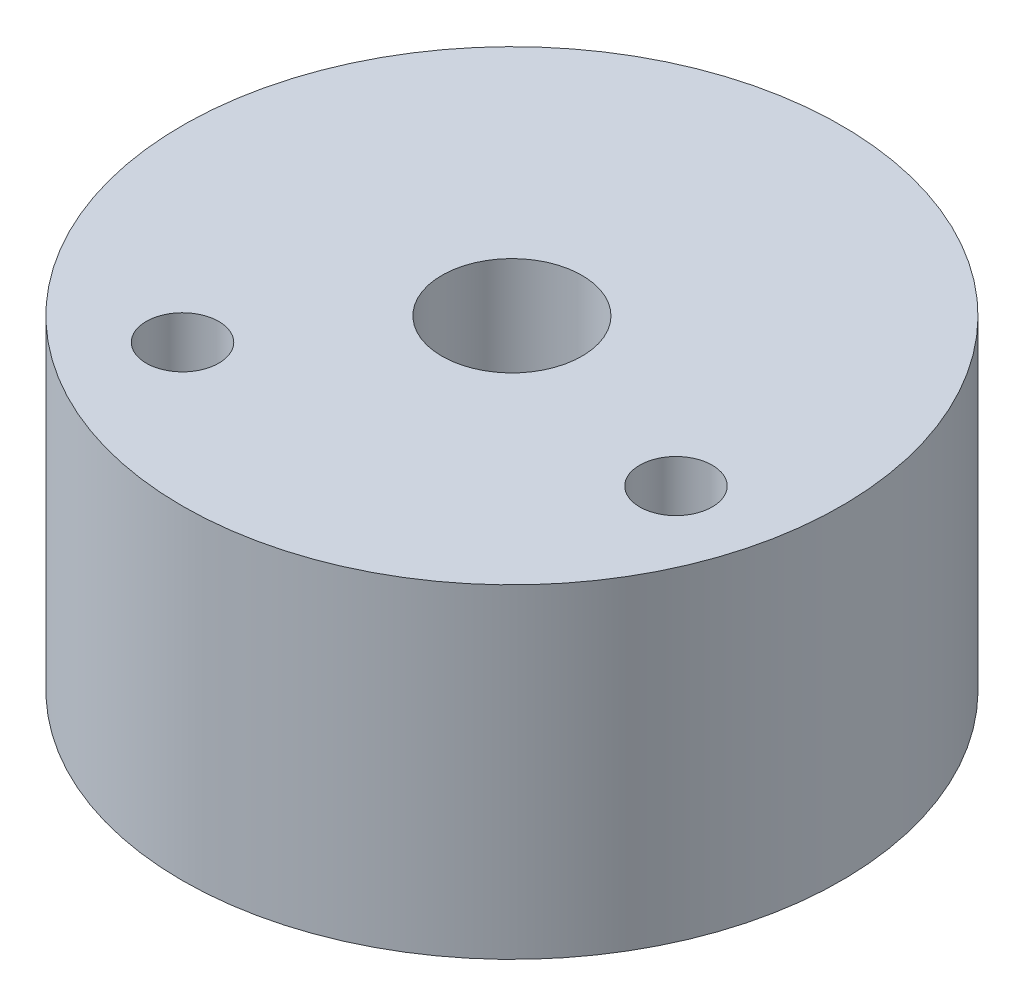
from build123d import *

# Parameters (mm, degrees)
CROQUIS1_W = 10
CROQUIS1_H = 12.5


# Read off the part's stored shape, not the designer's step: Taladro de margen para #31
with BuildPart() as part:
    # Croquis1 → Revolución1 (revolve)
    with BuildSketch(Plane.XY, mode=Mode.PRIVATE) as revoluci_n1_sk:
        with Locations((-7.7, 0)):
            Rectangle(CROQUIS1_W, CROQUIS1_H)
    revolve(revoluci_n1_sk.sketch.rotate(Axis((0, 15.597345133, 0), (0, -1, 0)), 270), axis=Axis((0, 15.597345133, 0), (0, -1, 0)))

    # Taladro de margen para #31 outline → Taladro de margen para #31 (revolve, cut)
    with BuildSketch(Plane(origin=(8.843839823, 0, 2.522833733), x_dir=(1, 0, 0), z_dir=(0, 0, 1))):
        Polygon((0, 6.25), (0, 2.410597715), (1.397, 3.25), (1.397, 6.25), align=None)
    revolve(axis=Axis((8.843839823, 0, 2.522833733), (0, 1, 0)), mode=Mode.SUBTRACT)

    # Taladro de margen para _31 2 outline → Taladro de margen para _31 2 (revolve, cut)
    with BuildSketch(Plane(origin=(-5.461397488, 0, 7.233375916), x_dir=(1, 0, 0), z_dir=(0, 0, 1))):
        Polygon((0, 6.25), (0, 2.410597715), (1.397, 3.25), (1.397, 6.25), align=None)
    revolve(axis=Axis((-5.461397488, 0, 7.233375916), (0, 1, 0)), mode=Mode.SUBTRACT)


solid = part.part
